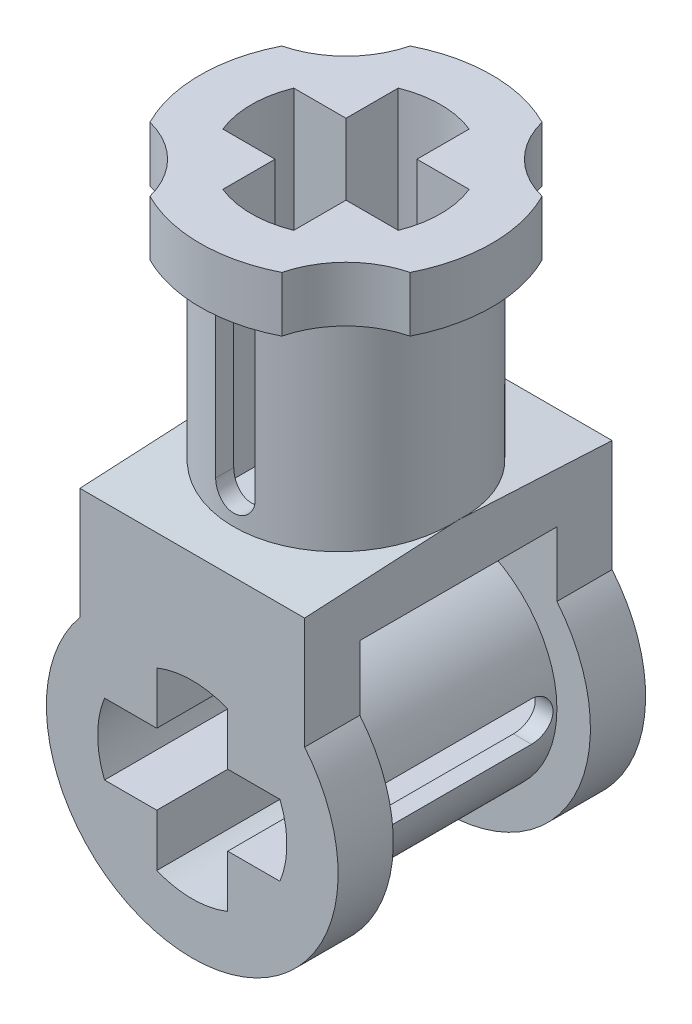
from build123d import *

# Parameters (mm, degrees)
SKETCH1_R             = 2.85
MIDDLE_BODY_DEPTH     = 2.55
SKETCH2_R             = 3.7
OUTER_RIM_DEPTH       = 1.4
AXLE_CUT_DEPTH        = 7.556104026
AXLE_CUT_DEPTH_BACK   = 7.556104026
SLOT_CUT_DEPTH        = 7.556104026
SLOT_CUT_DEPTH_BACK   = 7.556104026
SKETCH5_R             = 2.24600999
SCALLOP_CUT_DEPTH     = 1.4
SKETCH6_R             = 2.85
MIDDLE_TOP_DEPTH      = 3.9
SKETCH7_R             = 3.7
TOP_RIM_DEPTH         = 1.4
AXLE_JOINT_DEPTH      = 2.85
SKETCH9_W             = 7.8
SKETCH9_H             = 3.040444957
SIDE_CUT_DEPTH        = 5.7
SKETCH10_W            = 5
SKETCH10_H            = 1.640444957
MIDDLE_WALL_DEPTH     = 0.7
DRAFT1_ANGLE          = 3
DRAFT2_ANGLE          = -3
AXLE_CUT_2_DEPTH      = 13.830529997
AXLE_CUT_2_DEPTH_BACK = 13.830529997
TOP_SLOT_DEPTH        = 13.830529997
TOP_SLOT_DEPTH_BACK   = 13.830529997


with BuildPart() as part:
    # Sketch1 → Middle Body (new, symmetric)
    with BuildSketch(Plane(origin=(0, 0, 0), x_dir=(1, 0, 0), z_dir=(0, 1, 0))):
        Circle(SKETCH1_R)
    extrude(amount=MIDDLE_BODY_DEPTH, both=True)

    # Sketch2 → Outer Rim (add)
    with BuildSketch(Plane.XZ.offset(2.55)):
        Circle(SKETCH2_R)
    outer_rim = extrude(amount=OUTER_RIM_DEPTH)

    # Mirror1: Outer Rim across plane
    add(outer_rim.mirror(Plane.ZX))

    # Sketch3 → Axle Cut (cut, two sides: drawn at the far end of the back side and taken through both)
    with BuildSketch(Plane(origin=(0, 0, 0), x_dir=(1, 0, 0), z_dir=(0, 1, 0)).offset(-AXLE_CUT_DEPTH_BACK)):
        with BuildLine():
            Line((0.9, -0.9), (2.224859546, -0.9))
            ThreePointArc((2.224859546, -0.9), (2.4, 0), (2.224859546, 0.9))
            Line((2.224859546, 0.9), (0.9, 0.9))
            Line((0.9, 0.9), (0.9, 2.224859546))
            ThreePointArc((0.9, 2.224859546), (0, 2.4), (-0.9, 2.224859546))
            Line((-0.9, 2.224859546), (-0.9, 0.9))
            Line((-0.9, 0.9), (-2.224859546, 0.9))
            ThreePointArc((-2.224859546, 0.9), (-2.4, 0), (-2.224859546, -0.9))
            Line((-2.224859546, -0.9), (-0.9, -0.9))
            Line((-0.9, -0.9), (-0.9, -2.224859546))
            ThreePointArc((-0.9, -2.224859546), (0, -2.4), (0.9, -2.224859546))
            Line((0.9, -2.224859546), (0.9, -0.9))
        make_face()
    extrude(amount=AXLE_CUT_DEPTH + AXLE_CUT_DEPTH_BACK, mode=Mode.SUBTRACT)

    # Sketch4 → Slot Cut (cut, two sides: drawn at the far end of the back side and taken through both)
    with BuildSketch(Plane.XY.offset(-SLOT_CUT_DEPTH_BACK)):
        with BuildLine():
            Line((-0.5, -1.9), (-0.5, 1.9))
            ThreePointArc((-0.5, 1.9), (0, 2.4), (0.5, 1.9))
            Line((0.5, 1.9), (0.5, -1.9))
            ThreePointArc((0.5, -1.9), (0, -2.4), (-0.5, -1.9))
        make_face()
    extrude(amount=SLOT_CUT_DEPTH + SLOT_CUT_DEPTH_BACK, mode=Mode.SUBTRACT)

    # Sketch5 → Scallop Cut (cut)
    with BuildSketch(Plane(origin=(0, 3.95, 0), x_dir=(1, 0, 0), z_dir=(0, 1, 0))):
        with BuildLine():
            ThreePointArc((1.673541902, 3.299887499), (2.2627417, 2.2627417), (3.299887499, 1.673541902))
            ThreePointArc((3.299887499, 1.673541902), (2.61629509, 2.61629509), (1.673541902, 3.299887499))
        make_face()
        with BuildLine():
            ThreePointArc((-3.299887499, 1.673541902), (-2.2627417, 2.2627417), (-1.673541902, 3.299887499))
            ThreePointArc((-1.673541902, 3.299887499), (-2.61629509, 2.61629509), (-3.299887499, 1.673541902))
        make_face()
        with Locations((3.850910595, -3.850910595)):
            Circle(SKETCH5_R)
        with Locations((-3.850910595, -3.850910595)):
            Circle(SKETCH5_R)
    extrude(amount=-SCALLOP_CUT_DEPTH, mode=Mode.SUBTRACT)



with BuildPart() as body_2:
    # Sketch6 → Middle Top (new, symmetric)
    with BuildSketch(Plane.XY):
        with Locations((0, -7.95)):
            Circle(SKETCH6_R)
    extrude(amount=MIDDLE_TOP_DEPTH, both=True)

    # Sketch7 → Top Rim (add)
    with BuildSketch(Plane.XY.offset(3.9)):
        with Locations((0, -7.95)):
            Circle(SKETCH7_R)
    top_rim = extrude(amount=-TOP_RIM_DEPTH)

    # Mirror2: Top Rim across plane
    add(top_rim.mirror(Plane.XY))


with BuildPart() as part_1:
    add(part.part)

    add(body_2.part)  # Axle Joint merges body 2
    # Sketch8 → Axle Joint (add, symmetric)
    with BuildSketch(Plane(origin=(0, 0, 0), x_dir=(0, 0, -1), z_dir=(1, 0, 0))):
        Polygon((3.9, -2.55), (-3.9, -2.55), (-3.9, -6.1), (-2.5, -6.1), (-2.5, -3.95), (2.5, -3.95), (2.5, -6.1), (3.9, -6.1), align=None)
    extrude(amount=AXLE_JOINT_DEPTH, both=True)

    # Sketch9 → Side Cut (cut)
    with BuildSketch(Plane(origin=(2.85, 0, 0), x_dir=(0, 0, -1), z_dir=(1, 0, 0))):
        with Locations((0, -4.070222479)):
            Rectangle(SKETCH9_W, SKETCH9_H)
    side_cut = extrude(amount=SIDE_CUT_DEPTH, mode=Mode.SUBTRACT)

    # Mirror3: Side Cut across plane
    add(side_cut.mirror(Plane(origin=(0, 0, 0), x_dir=(0, 0, 1), z_dir=(1, 0, 0))), mode=Mode.SUBTRACT)

    # Sketch10 → MIddle Wall (add, symmetric)
    with BuildSketch(Plane(origin=(0, 0, 0), x_dir=(0, 0, -1), z_dir=(1, 0, 0))):
        with Locations((0, -4.770222479)):
            Rectangle(SKETCH10_W, SKETCH10_H)
    extrude(amount=MIDDLE_WALL_DEPTH, both=True)

    # Draft1
    draft1_faces = [part_1.faces().sort_by_distance(p)[0] for p in [
        (0, -2.55, 2.947433256),
    ]]
    draft(draft1_faces, Plane.XY, DRAFT1_ANGLE)

    # Draft2
    draft2_faces = [part_1.faces().sort_by_distance(p)[0] for p in [
        (0, -2.55, -2.947433256),
    ]]
    draft(draft2_faces, Plane.XY, DRAFT2_ANGLE)

    # Sketch11 → Axle Cut 2 (cut, two sides: drawn at the far end of the back side and taken through both)
    with BuildSketch(Plane.XY.offset(-AXLE_CUT_2_DEPTH_BACK)):
        with BuildLine():
            ThreePointArc((-0.9, -10.174859546), (0, -10.35), (0.9, -10.174859546))
            Line((0.9, -10.174859546), (0.9, -8.85))
            Line((0.9, -8.85), (2.224859546, -8.85))
            ThreePointArc((2.224859546, -8.85), (2.4, -7.95), (2.224859546, -7.05))
            Line((2.224859546, -7.05), (0.9, -7.05))
            Line((0.9, -7.05), (0.9, -5.725140454))
            ThreePointArc((0.9, -5.725140454), (0, -5.55), (-0.9, -5.725140454))
            Line((-0.9, -5.725140454), (-0.9, -7.05))
            Line((-0.9, -7.05), (-2.224859546, -7.05))
            ThreePointArc((-2.224859546, -7.05), (-2.4, -7.95), (-2.224859546, -8.85))
            Line((-2.224859546, -8.85), (-0.9, -8.85))
            Line((-0.9, -8.85), (-0.9, -10.174859546))
        make_face()
    extrude(amount=AXLE_CUT_2_DEPTH + AXLE_CUT_2_DEPTH_BACK, mode=Mode.SUBTRACT)

    # Sketch12 → Top Slot (cut, two sides: drawn at the far end of the back side and taken through both)
    with BuildSketch(Plane(origin=(0, 0, 0), x_dir=(0, 0, -1), z_dir=(1, 0, 0)).offset(-TOP_SLOT_DEPTH_BACK)):
        with BuildLine():
            Line((-1.9, -7.45), (1.9, -7.45))
            ThreePointArc((1.9, -7.45), (2.4, -7.95), (1.9, -8.45))
            Line((1.9, -8.45), (-1.9, -8.45))
            ThreePointArc((-1.9, -8.45), (-2.4, -7.95), (-1.9, -7.45))
        make_face()
    extrude(amount=TOP_SLOT_DEPTH + TOP_SLOT_DEPTH_BACK, mode=Mode.SUBTRACT)


solid = part_1.part
